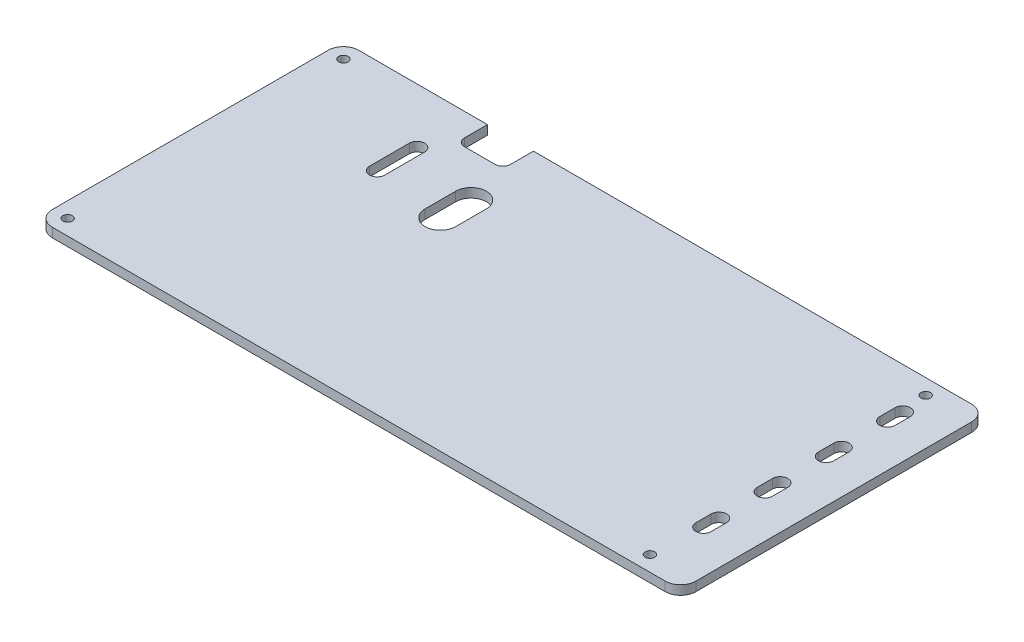
from build123d import *

# Parameters (mm, degrees)
SKETCH1_W           = 210
SKETCH1_H           = 100
BOSS_EXTRUDE1_DEPTH = 3
SKETCH2_R           = 1.55
CUT_EXTRUDE1_DEPTH  = 117.335721083
FILLET1_R           = 5
SKETCH3_W           = 15
SKETCH3_H           = 10
CUT_EXTRUDE2_DEPTH  = 117.335721083
FILLET2_R           = 2.5


with BuildPart() as part:
    # Sketch1 → Boss-Extrude1 (new body)
    with BuildSketch(Plane(origin=(0, 0, 0), x_dir=(1, 0, 0), z_dir=(0, 1, 0))):
        Rectangle(SKETCH1_W, SKETCH1_H)
    extrude(amount=BOSS_EXTRUDE1_DEPTH)

    # Sketch2 → Cut-Extrude1 (cut, through all)
    with BuildSketch(Plane(origin=(0, 3, 0), x_dir=(1, 0, 0), z_dir=(0, 1, 0))):
        with Locations((-100, 45)):
            Circle(SKETCH2_R)
        with Locations((-100, -45)):
            Circle(SKETCH2_R)
        with Locations((90, 45)):
            Circle(SKETCH2_R)
        with Locations((90, -45)):
            Circle(SKETCH2_R)
    extrude(amount=-CUT_EXTRUDE1_DEPTH, mode=Mode.SUBTRACT)

    # Fillet1
    fillet1_edges = [part.edges().sort_by_distance(p)[0] for p in [
        (-105, 1.5, -50),
        (105, 1.5, -50),
        (105, 1.5, 50),
        (-105, 1.5, 50),
    ]]
    fillet(fillet1_edges, radius=FILLET1_R)

    # Sketch3 → Cut-Extrude2 (cut, through all)
    with BuildSketch(Plane(origin=(0, 3, 0), x_dir=(1, 0, 0), z_dir=(0, 1, 0))):
        with BuildLine():
            Line((-60.5, 32), (-60.5, 19))
            ThreePointArc((-60.5, 19), (-63, 16.5), (-65.5, 19))
            Line((-65.5, 19), (-65.5, 32))
            ThreePointArc((-65.5, 32), (-63, 34.5), (-60.5, 32))
        make_face()
        with BuildLine():
            Line((-34.365, 26), (-34.365, 16))
            ThreePointArc((-34.365, 16), (-39.365, 11), (-44.365, 16))
            Line((-44.365, 16), (-44.365, 26))
            ThreePointArc((-44.365, 26), (-39.365, 31), (-34.365, 26))
        make_face()
        with Locations((-50.5, 45)):
            Rectangle(SKETCH3_W, SKETCH3_H)
        with BuildLine():
            Line((93.5, 36.5), (93.5, 31.5))
            ThreePointArc((93.5, 31.5), (91, 29), (88.5, 31.5))
            Line((88.5, 31.5), (88.5, 36.5))
            ThreePointArc((88.5, 36.5), (91, 39), (93.5, 36.5))
        make_face()
        with BuildLine():
            Line((93.5, 16.5), (93.5, 11.5))
            ThreePointArc((93.5, 11.5), (91, 9), (88.5, 11.5))
            Line((88.5, 11.5), (88.5, 16.5))
            ThreePointArc((88.5, 16.5), (91, 19), (93.5, 16.5))
        make_face()
        with BuildLine():
            Line((93.5, -3.5), (93.5, -8.5))
            ThreePointArc((93.5, -8.5), (91, -11), (88.5, -8.5))
            Line((88.5, -8.5), (88.5, -3.5))
            ThreePointArc((88.5, -3.5), (91, -1), (93.5, -3.5))
        make_face()
        with BuildLine():
            Line((93.5, -23.5), (93.5, -28.5))
            ThreePointArc((93.5, -28.5), (91, -31), (88.5, -28.5))
            Line((88.5, -28.5), (88.5, -23.5))
            ThreePointArc((88.5, -23.5), (91, -21), (93.5, -23.5))
        make_face()
    extrude(amount=-CUT_EXTRUDE2_DEPTH, mode=Mode.SUBTRACT)

    # Fillet2
    fillet2_edges = [part.edges().sort_by_distance(p)[0] for p in [
        (-43, 1.5, -40),
        (-58, 1.5, -40),
    ]]
    fillet(fillet2_edges, radius=FILLET2_R)


solid = part.part
